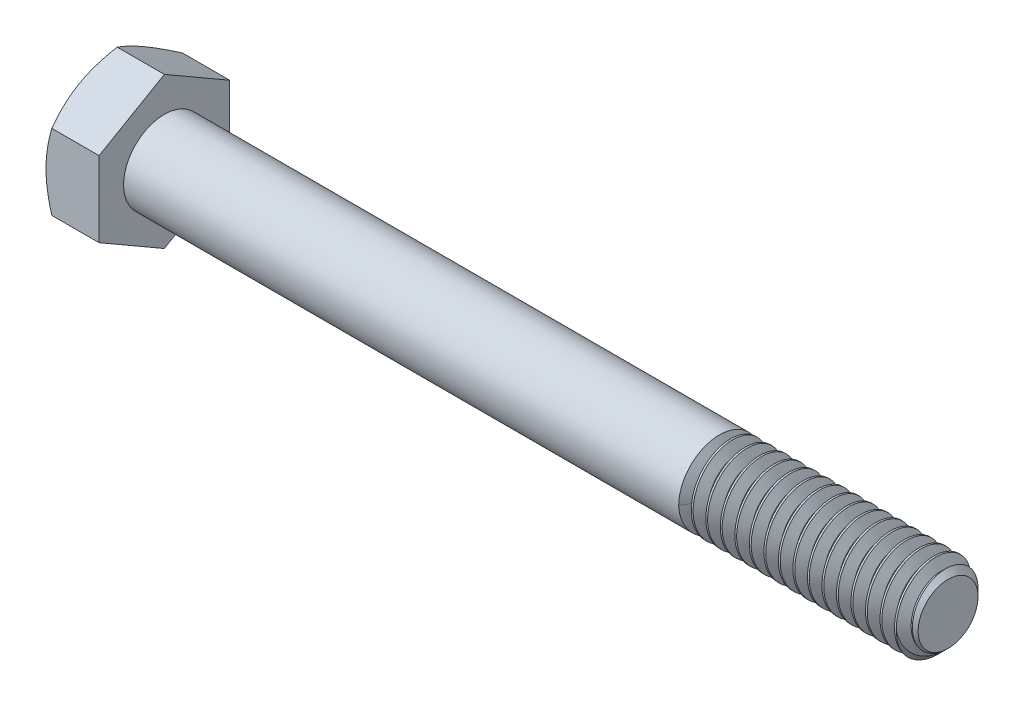
from build123d import *

# Parameters (mm, degrees)
SKETCH5_R           = 3.96875
BOSS_EXTRUDE3_DEPTH = 76.2
CHAMFER1_SIZE       = 1.058333333
BOSS_EXTRUDE4_DEPTH = 5.159375
SKETCH8_OUTSIDE_W   = 318.726
SKETCH8_OUTSIDE_H   = 320.69
SKETCH8_OUTSIDE_R   = 6.35
CUT_EXTRUDE3_DEPTH  = 82.935546216
CUT_EXTRUDE3_DRAFT  = -60
CUT_EXTRUDE4_DEPTH  = 0.254
CIRPATTERN1_COUNT   = 6
CUT_SWEEP1_PITCH    = 1.411111111
CUT_SWEEP1_TO       = 22.225


with BuildPart() as part:
    # Sketch5 → Boss-Extrude3 (new body)
    with BuildSketch(Plane(origin=(40.6796875, 0, 0), x_dir=(0, 0, -1), z_dir=(1, 0, 0))):
        Circle(SKETCH5_R)
    extrude(amount=-BOSS_EXTRUDE3_DEPTH)

    # Chamfer1
    chamfer1_edges = [part.edges().sort_by_distance(p)[0] for p in [
        (40.6796875, 0, 3.96875),
    ]]
    chamfer(chamfer1_edges, length=CHAMFER1_SIZE)

    # Sketch11 → Revolve1 (revolve)
    with BuildSketch(Plane.XY):
        Polygon((-35.5203125, 3.96875), (-35.5203125, 0), (25.5984375, 0), (21.6296875, 3.96875), align=None)
    revolve(axis=Axis((-35.5203125, 0, 0), (1, 0, 0)))

    # Sketch6 → Boss-Extrude4 (add)
    with BuildSketch(Plane.ZY.offset(35.5203125)):
        Polygon((6.35, 3.666174209), (0, 7.332348419), (-6.35, 3.666174209), (-6.35, -3.666174209), (0, -7.332348419), (6.35, -3.666174209), align=None)
    extrude(amount=BOSS_EXTRUDE4_DEPTH)


with BuildPart() as cut_extrude3_tool:
    # Sketch8 outside → Cut-Extrude3 (with draft: the straight prism first)
    with BuildSketch(Plane.ZY.offset(40.6796875)):
        Rectangle(SKETCH8_OUTSIDE_W, SKETCH8_OUTSIDE_H)
        Circle(SKETCH8_OUTSIDE_R, mode=Mode.SUBTRACT)
    extrude(amount=-CUT_EXTRUDE3_DEPTH)
    # Cut-Extrude3: the draft: its side faces are tilted about the plane it starts from
    cut_extrude3_sides = [cut_extrude3_tool.faces().sort_by_distance(p)[0] for p in [
        (0.788085608, -160.345, 0),
        (0.788085608, 0, 159.363),
        (0.788085608, 160.345, 0),
        (0.788085608, 0, -159.363),
        (0.788085608, 0, -6.35),
    ]]
    draft(cut_extrude3_sides, Plane.ZY.offset(40.6796875), CUT_EXTRUDE3_DRAFT)


with BuildPart() as part_1:
    add(part.part)

    # Cut-Extrude3: cut by cut_extrude3_tool
    add(cut_extrude3_tool.part, mode=Mode.SUBTRACT)

    # Sketch12 → Cut-Extrude4 (cut)
    with BuildSketch(Plane.ZY.offset(40.6796875)):
        with BuildLine():
            Line((0.1905, 4.8895), (0.1905, 2.7305))
            ThreePointArc((0.1905, 2.7305), (0, 2.54), (-0.1905, 2.7305))
            Line((-0.1905, 2.7305), (-0.1905, 4.8895))
            ThreePointArc((-0.1905, 4.8895), (0, 5.08), (0.1905, 4.8895))
        make_face()
    cut_extrude4 = extrude(amount=-CUT_EXTRUDE4_DEPTH, mode=Mode.SUBTRACT)

    # CirPattern1: Cut-Extrude4 ×6 about axis
    cirpattern1_axis = Axis((0, 0, 0), (1, 0, 0))
    for i in range(1, CIRPATTERN1_COUNT):
        add(cut_extrude4.rotate(cirpattern1_axis, i * 360 / CIRPATTERN1_COUNT), mode=Mode.SUBTRACT)


with BuildPart() as body_2:
    # Split1: the piece on the far side of the plane
    add(part_1.part)
    split(bisect_by=Plane(origin=(18.4546875, 0, 0), x_dir=(0, 0, 1), z_dir=(1, 0, 0)), keep=Keep.BOTTOM)


with BuildPart() as part_2:
    add(part_1.part)

    # Split1
    split(bisect_by=Plane(origin=(18.4546875, 0, 0), x_dir=(0, 0, 1), z_dir=(1, 0, 0)), keep=Keep.TOP)

    # Cut-Sweep1: arcs per turn and ends read off the stored shape
    # Cut-Sweep1: the profile of Sketch10 profile screwed along a right-hand helix through 16.75 turns, 8 arcs to a turn; built about Z, then put on its axis
    cut_sweep1_z = Axis((0, 0, 0), (0, 0, 1))
    cut_sweep1_corners = [(3.96905, 0, 0.000173205), (3.052206448, 0, -0.529166667), (3.052206448, 0, -0.705555556), (3.96905, 0, -1.234895427)]
    with BuildLine(mode=Mode.PRIVATE) as cut_sweep1_profile:
        Line(cut_sweep1_corners[0], cut_sweep1_corners[1])
        Line(cut_sweep1_corners[1], cut_sweep1_corners[2])
        Line(cut_sweep1_corners[2], cut_sweep1_corners[3])
        Line(cut_sweep1_corners[3], cut_sweep1_corners[0])
    cut_sweep1_cap = Face(cut_sweep1_profile.wire())
    cut_sweep1_turn_angles = [0, 22.5, 45, 67.5, 90, 112.5, 135, 157.5, 180, 202.5, 225, 247.5, 270, 292.5, 315, 337.5, 360]
    cut_sweep1_turn_weights = [1, 0.9238795325112867, 1, 0.9238795325112867, 1, 0.9238795325112867, 1, 0.9238795325112867, 1, 0.9238795325112867, 1, 0.9238795325112867, 1, 0.9238795325112867, 1, 0.9238795325112867, 1]
    cut_sweep1_turn_rails = [Edge.make_bspline([Vector(p[0], p[1], 0).rotate(cut_sweep1_z, cut_sweep1_turn_angles[k]) / cut_sweep1_turn_weights[k] + Vector(0, 0, p[2] + CUT_SWEEP1_PITCH * cut_sweep1_turn_angles[k] / 360) for k in range(17)], [0, 0, 0, 1, 1, 2, 2, 3, 3, 4, 4, 5, 5, 6, 6, 7, 7, 8, 8, 8], 2, cut_sweep1_turn_weights) for p in cut_sweep1_corners]
    cut_sweep1_turn_sides = [Face.make_surface_from_curves(cut_sweep1_turn_rails[p[0]], cut_sweep1_turn_rails[p[1]]) for p in [(0, 1), (1, 2), (2, 3), (3, 0)]]
    cut_sweep1_last_angles = [5760, 5782.5, 5805, 5827.5, 5850, 5872.5, 5895, 5917.5, 5940, 5962.5, 5985, 6007.5, 6030]
    cut_sweep1_last_weights = [1, 0.9238795325112867, 1, 0.9238795325112867, 1, 0.9238795325112867, 1, 0.9238795325112867, 1, 0.9238795325112867, 1, 0.9238795325111105, 1]
    cut_sweep1_last_rails = [Edge.make_bspline([Vector(p[0], p[1], 0).rotate(cut_sweep1_z, cut_sweep1_last_angles[k]) / cut_sweep1_last_weights[k] + Vector(0, 0, p[2] + CUT_SWEEP1_PITCH * cut_sweep1_last_angles[k] / 360) for k in range(13)], [0, 0, 0, 1, 1, 2, 2, 3, 3, 4, 4, 5, 5, 6, 6, 6], 2, cut_sweep1_last_weights) for p in cut_sweep1_corners]
    cut_sweep1_last_sides = [Face.make_surface_from_curves(cut_sweep1_last_rails[p[0]], cut_sweep1_last_rails[p[1]]) for p in [(0, 1), (1, 2), (2, 3), (3, 0)]]
    cut_sweep1 = Plane(origin=(40.6796875, 0, 0), x_dir=(0, 1, 0), z_dir=(-1, 0, 0)) * split(Solid(Shell([*[p.moved(Location((0, 0, CUT_SWEEP1_PITCH * i))) for i in range(16) for p in cut_sweep1_turn_sides], *cut_sweep1_last_sides, cut_sweep1_cap, cut_sweep1_cap.rotate(cut_sweep1_z, 6030).moved(Location((0, 0, CUT_SWEEP1_PITCH * 6030 / 360)))])), bisect_by=Plane.XY.offset(CUT_SWEEP1_TO), keep=Keep.BOTTOM, mode=Mode.PRIVATE)
    add(cut_sweep1, mode=Mode.SUBTRACT)

    add(body_2.part)  # Boss-Extrude5 merges body 2
    # Boss-Extrude5: read off the stored shape, not the designer's step
    # Boss-Extrude5 outline → Boss-Extrude5 (revolve)
    with BuildSketch(Plane.YX):
        Polygon((3.96875, 18.4546875), (3.052197263, 18.983859469), (3.052197263, 18.4546875), align=None)
    revolve(axis=Axis((0, 0, 0), (1, 0, 0)))


solid = part_2.part
